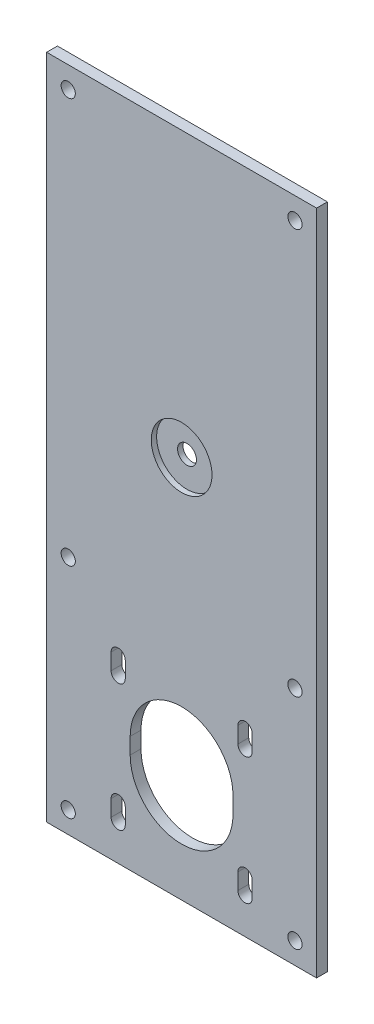
from build123d import *

# Parameters (mm, degrees)
SKETCH1_W           = 100
SKETCH1_H           = 247
SKETCH1_R           = 2.625
SKETCH1_R_2         = 3.5
BOSS_EXTRUDE1_DEPTH = 4
SKETCH2_R           = 11.25
CUT_EXTRUDE1_DEPTH  = 2


with BuildPart() as part:
    # Sketch1 → Boss-Extrude1 (new body)
    with BuildSketch(Plane.XY):
        Rectangle(SKETCH1_W, SKETCH1_H)
        with Locations((-42, -34.5)):
            Circle(SKETCH1_R, mode=Mode.SUBTRACT)
        with Locations((42, -34.5)):
            Circle(SKETCH1_R, mode=Mode.SUBTRACT)
        with Locations((-42, -115.5)):
            Circle(SKETCH1_R, mode=Mode.SUBTRACT)
        with Locations((42, -115.5)):
            Circle(SKETCH1_R, mode=Mode.SUBTRACT)
        with Locations((0, 18.5)):
            Circle(SKETCH1_R_2, mode=Mode.SUBTRACT)
        with Locations((42, 115.5)):
            Circle(SKETCH1_R, mode=Mode.SUBTRACT)
        with Locations((-42, 115.5)):
            Circle(SKETCH1_R, mode=Mode.SUBTRACT)
        with BuildLine():
            Line((-19.05, -80.5), (-19.05, -86.5))
            ThreePointArc((-19.05, -86.5), (0, -105.55), (19.05, -86.5))
            Line((19.05, -86.5), (19.05, -80.5))
            ThreePointArc((19.05, -80.5), (0, -61.45), (-19.05, -80.5))
        make_face(mode=Mode.SUBTRACT)
        with BuildLine():
            Line((-20.87, -57), (-20.87, -63))
            ThreePointArc((-20.87, -63), (-23.5, -65.63), (-26.13, -63))
            Line((-26.13, -63), (-26.13, -57))
            ThreePointArc((-26.13, -57), (-23.5, -54.37), (-20.87, -57))
        make_face(mode=Mode.SUBTRACT)
        with BuildLine():
            Line((20.87, -57), (20.87, -63))
            ThreePointArc((20.87, -63), (23.5, -65.63), (26.13, -63))
            Line((26.13, -63), (26.13, -57))
            ThreePointArc((26.13, -57), (23.5, -54.37), (20.87, -57))
        make_face(mode=Mode.SUBTRACT)
        with BuildLine():
            Line((20.87, -110), (20.87, -104))
            ThreePointArc((20.87, -104), (23.5, -101.37), (26.13, -104))
            Line((26.13, -104), (26.13, -110))
            ThreePointArc((26.13, -110), (23.5, -112.63), (20.87, -110))
        make_face(mode=Mode.SUBTRACT)
        with BuildLine():
            Line((-20.87, -110), (-20.87, -104))
            ThreePointArc((-20.87, -104), (-23.5, -101.37), (-26.13, -104))
            Line((-26.13, -104), (-26.13, -110))
            ThreePointArc((-26.13, -110), (-23.5, -112.63), (-20.87, -110))
        make_face(mode=Mode.SUBTRACT)
    extrude(amount=BOSS_EXTRUDE1_DEPTH)

    # Sketch2 → Cut-Extrude1 (cut)
    with BuildSketch(Plane.XY.offset(4)):
        with Locations((0, 18.5)):
            Circle(SKETCH2_R)
    extrude(amount=-CUT_EXTRUDE1_DEPTH, mode=Mode.SUBTRACT)


solid = part.part
